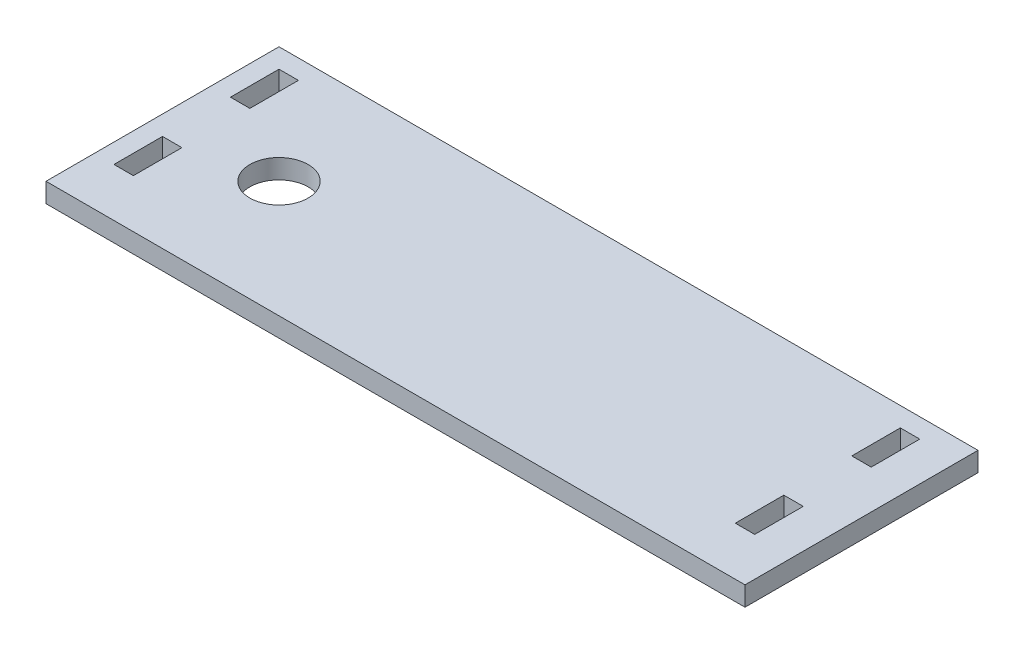
from build123d import *

# Parameters (mm, degrees)
SKETCH1_W           = 228.6
SKETCH1_H           = 76.2
SKETCH1_R           = 9.525
SKETCH1_W_2         = 6.35
SKETCH1_H_2         = 15.875
BOSS_EXTRUDE1_DEPTH = 6.35


with BuildPart() as part:
    # Sketch1 → Boss-Extrude1 (new body)
    with BuildSketch(Plane(origin=(0, 0, 0), x_dir=(1, 0, 0), z_dir=(0, 1, 0))):
        Rectangle(SKETCH1_W, SKETCH1_H)
        with Locations((-76.2, 0)):
            Circle(SKETCH1_R, mode=Mode.SUBTRACT)
        with Locations((-104.775, -14.2875)):
            Rectangle(SKETCH1_W_2, SKETCH1_H_2, mode=Mode.SUBTRACT)
        with Locations((-104.775, 23.8125)):
            Rectangle(SKETCH1_W_2, SKETCH1_H_2, mode=Mode.SUBTRACT)
        with Locations((98.425, 23.8125)):
            Rectangle(SKETCH1_W_2, SKETCH1_H_2, mode=Mode.SUBTRACT)
        with Locations((98.425, -14.2875)):
            Rectangle(SKETCH1_W_2, SKETCH1_H_2, mode=Mode.SUBTRACT)
    extrude(amount=BOSS_EXTRUDE1_DEPTH)


solid = part.part
